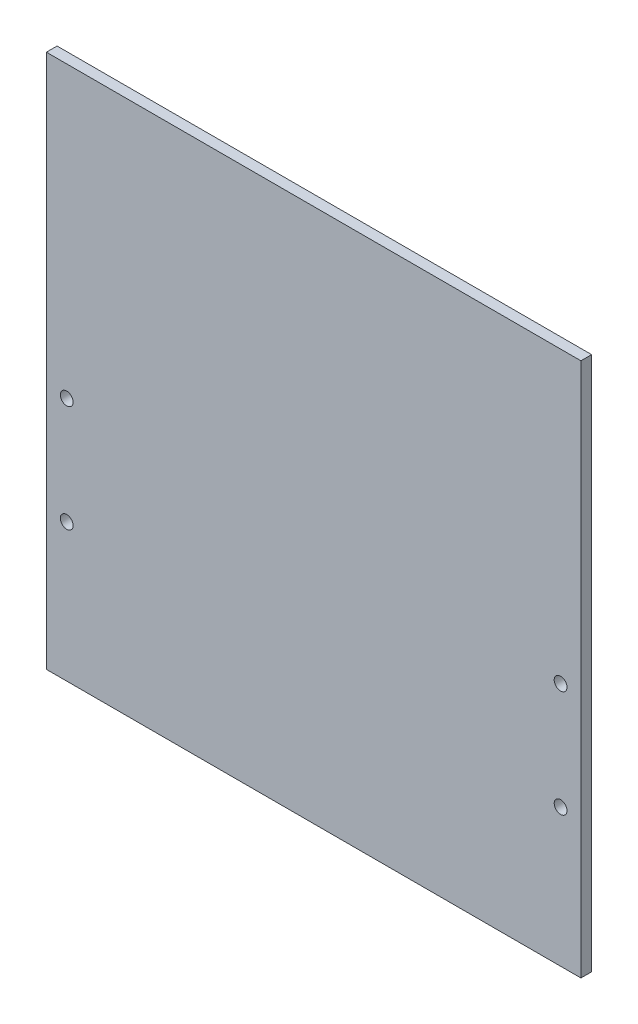
from build123d import *

# Parameters (mm, degrees)
SKETCH1_W           = 250
SKETCH1_H           = 250
SKETCH1_R           = 3
BOSS_EXTRUDE1_DEPTH = 5


with BuildPart() as part:
    # Sketch1 → Boss-Extrude1 (new body)
    with BuildSketch(Plane.XY):
        Rectangle(SKETCH1_W, SKETCH1_H)
        with Locations((-115.5, -10.5)):
            Circle(SKETCH1_R, mode=Mode.SUBTRACT)
        with Locations((-115.5, -60.5)):
            Circle(SKETCH1_R, mode=Mode.SUBTRACT)
        with Locations((115.5, -10.5)):
            Circle(SKETCH1_R, mode=Mode.SUBTRACT)
        with Locations((115.5, -60.5)):
            Circle(SKETCH1_R, mode=Mode.SUBTRACT)
    extrude(amount=BOSS_EXTRUDE1_DEPTH)


solid = part.part
